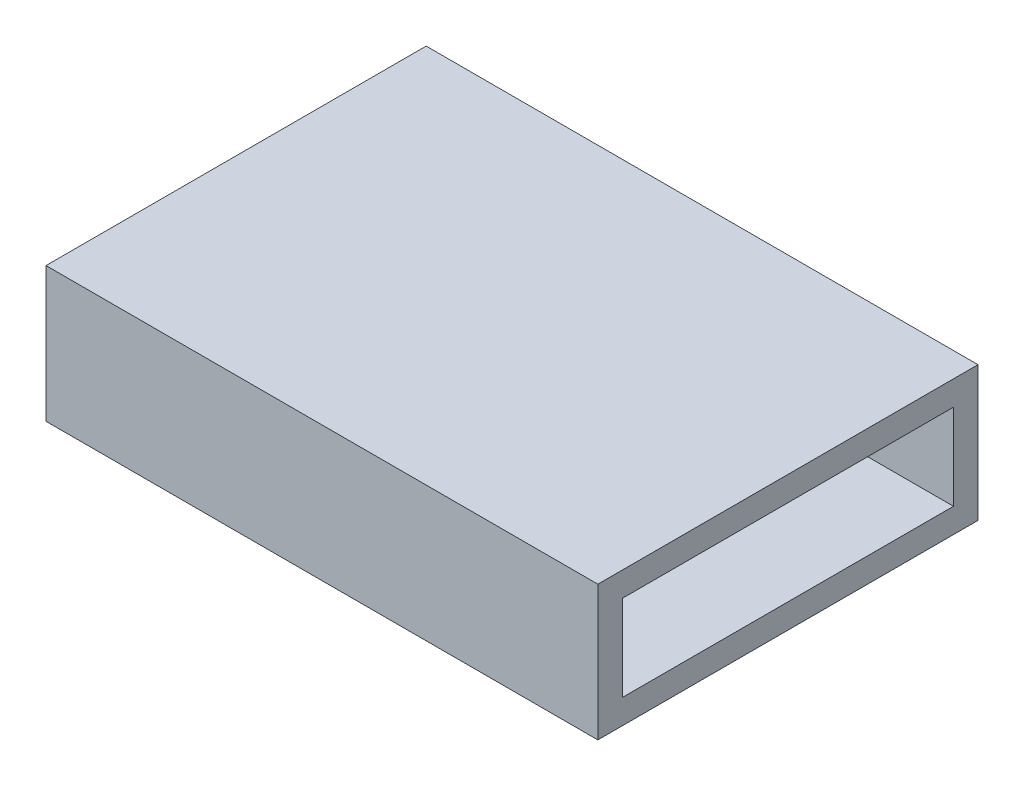
from build123d import *

# Parameters (mm, degrees)
BOSS_EXTRUDE1_DEPTH      = 9
BOSS_EXTRUDE1_DEPTH_BACK = 9
SKETCH1_W                = 12.4
SKETCH1_H                = 4.4
SKETCH1_W_2              = 10.8
SKETCH1_H_2              = 2.8
BOSS_EXTRUDE2_DEPTH      = 0.5
BOSS_EXTRUDE2_DEPTH_BACK = 0.5
BOSS_EXTRUDE3_START      = 5
BOSS_EXTRUDE3_DEPTH      = 2
CHAMFER1_SIZE            = 2
CHAMFER1_SIZE_2          = 0.76772807


with BuildPart() as part:
    # Sketch1 → Boss-Extrude1 (new, two sides: drawn at the far end of the back side and taken through both)
    with BuildSketch(Plane(origin=(0, 0, 0), x_dir=(0, 0, -1), z_dir=(1, 0, 0)).offset(-BOSS_EXTRUDE1_DEPTH_BACK)):
        Rectangle(SKETCH1_W, SKETCH1_H)
        Rectangle(SKETCH1_W_2, SKETCH1_H_2, mode=Mode.SUBTRACT)
    extrude(amount=BOSS_EXTRUDE1_DEPTH + BOSS_EXTRUDE1_DEPTH_BACK)

    # Sketch1<3> → Boss-Extrude2 (add, two sides: drawn at the far end of the back side and taken through both)
    with BuildSketch(Plane(origin=(0, 0, 0), x_dir=(0, 0, -1), z_dir=(1, 0, 0)).offset(-BOSS_EXTRUDE2_DEPTH_BACK)):
        Polygon((-5.4, 1.4), (-5.4, 0), (-4, 1.4), align=None)
        Polygon((4, 1.4), (5.4, 0), (5.4, 1.4), align=None)
        Polygon((-5.4, 0), (-5.4, -1.4), (-4, -1.4), align=None)
        Polygon((5.4, 0), (4, -1.4), (5.4, -1.4), align=None)
    extrude(amount=BOSS_EXTRUDE2_DEPTH + BOSS_EXTRUDE2_DEPTH_BACK)

    # Sketch1<4> → Boss-Extrude3 (add)
    with BuildSketch(Plane(origin=(0, 0, 0), x_dir=(0, 0, -1), z_dir=(1, 0, 0)).offset(BOSS_EXTRUDE3_START)):
        with BuildLine():
            Line((1.5, 1.4), (-1.5, 1.4))
            ThreePointArc((-1.5, 1.4), (0, 0.9), (1.5, 1.4))
        make_face()
    extrude(amount=BOSS_EXTRUDE3_DEPTH)

    # Chamfer1
    # the kernel refuses this chamfer: 2, 0.76772807 mm, written as the material it takes off along each edge
    with BuildSketch(Plane(origin=(7, 3.4, 0), x_dir=(0, 0.9120061732371908, 0.4101764741879463), z_dir=(0, 0.4101764741879463, -0.9120061732371908))) as chamfer1_piece_1_section:
        Polygon((2.5, -CHAMFER1_SIZE), (2.5 - CHAMFER1_SIZE_2, 0), (2.5, 0), align=None)
    chamfer1_piece_1 = revolve(axis=Axis((7, 3.4, 0), (1, 0, 0)), revolution_arc=311.56815777, mode=Mode.PRIVATE)
    chamfer1_piece_1 = split(chamfer1_piece_1, bisect_by=Plane(origin=(6.216344198, 1.4, 0), z_dir=(0, -1, 0)), keep=Keep.TOP, mode=Mode.PRIVATE)
    add(chamfer1_piece_1, mode=Mode.SUBTRACT)


solid = part.part
